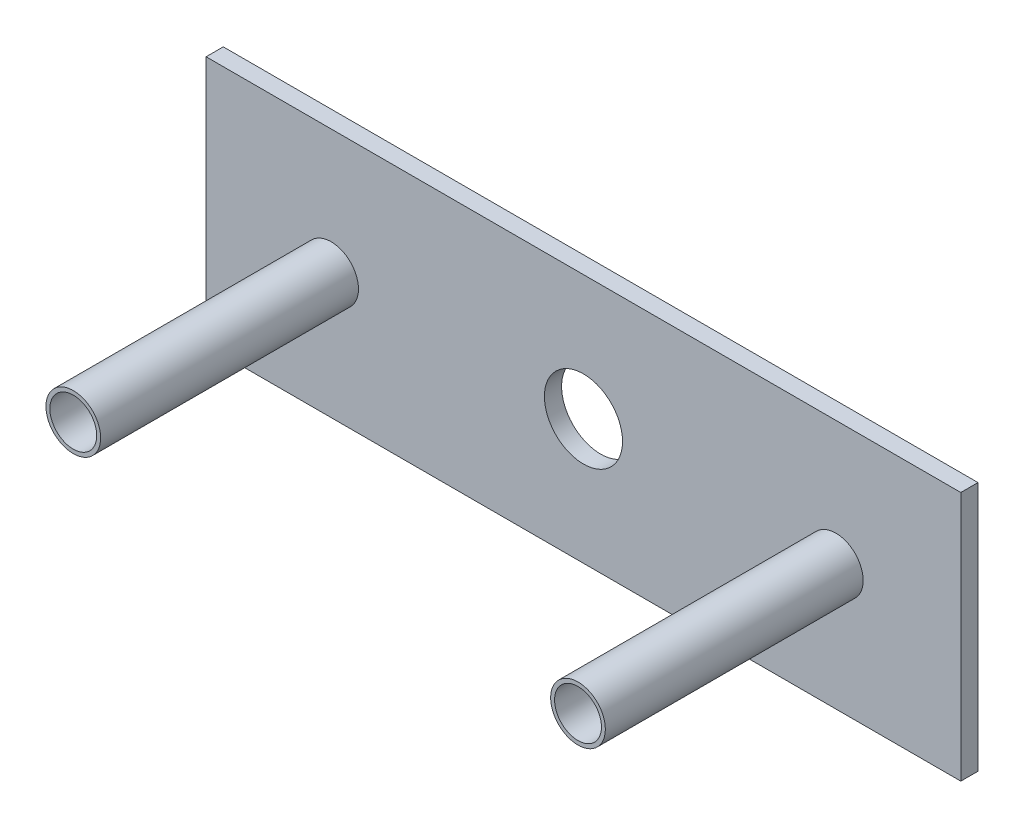
from build123d import *

# Parameters (mm, degrees)
ESQUISSE1_W             = 96.6
ESQUISSE1_H             = 32
BOSS_EXTRU_1_DEPTH      = 2.2
ESQUISSE6_R             = 3.5
BOSS_EXTRU_2_DEPTH      = 33
ESQUISSE7_R             = 3
ESQUISSE7_R_2           = 5
ENL_V_MAT_EXTRU_1_DEPTH = 64.013010851


with BuildPart() as part:
    # Esquisse1 → Boss.-Extru.1 (new body)
    with BuildSketch(Plane.XY):
        with Locations((0.671156739, 2.259938231)):
            Rectangle(ESQUISSE1_W, ESQUISSE1_H)
    extrude(amount=BOSS_EXTRU_1_DEPTH)

    # Esquisse6 → Boss.-Extru.2 (add)
    with BuildSketch(Plane.XY.offset(2.2)):
        with Locations((-31.628843261, 2.259938231)):
            Circle(ESQUISSE6_R)
        with Locations((32.971156739, 2.259938231)):
            Circle(ESQUISSE6_R)
    extrude(amount=BOSS_EXTRU_2_DEPTH)

    # Esquisse7 → Enlèv. mat.-Extru.1 (cut, through all)
    with BuildSketch(Plane.XY.offset(35.2)):
        with Locations((-31.628843261, 2.259938231)):
            Circle(ESQUISSE7_R)
        with Locations((32.971156739, 2.259938231)):
            Circle(ESQUISSE7_R)
        with Locations((0.671156739, 2.259938231)):
            Circle(ESQUISSE7_R_2)
    extrude(amount=-ENL_V_MAT_EXTRU_1_DEPTH, mode=Mode.SUBTRACT)


solid = part.part
